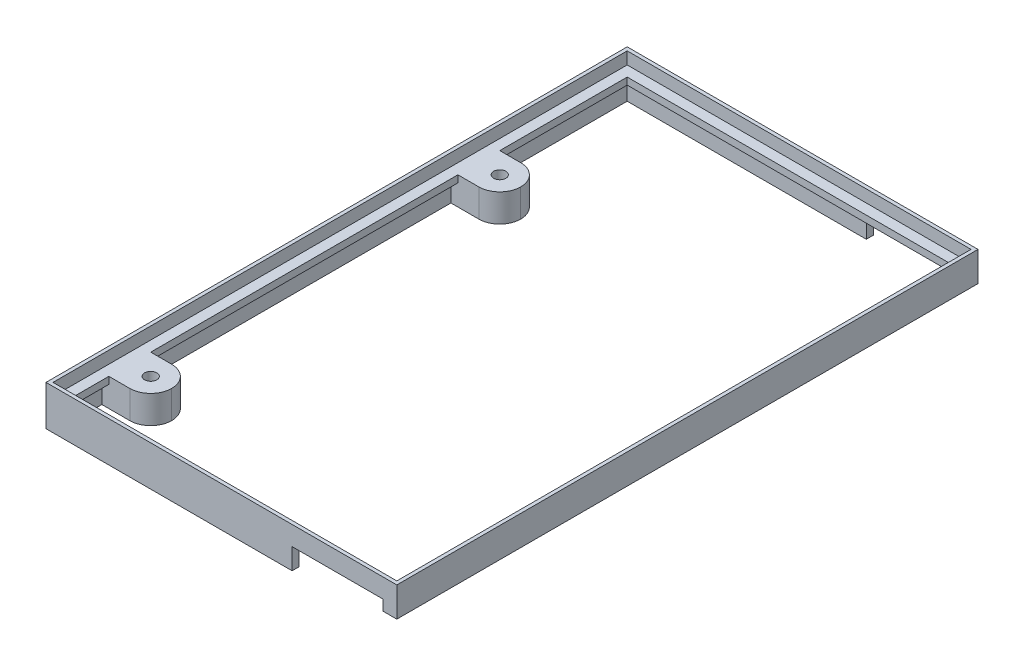
from build123d import *

# Parameters (mm, degrees)
SKETCH2_W                                      = 100.5
SKETCH2_H                                      = 166.5
SKETCH2_W_2                                    = 98.5
SKETCH2_H_2                                    = 164.5
DIAPLAY_RING_DEPTH                             = 3.5
SKETCH3_W                                      = 100.5
SKETCH3_H                                      = 166.5
SKETCH3_W_2                                    = 92.5
SKETCH3_H_2                                    = 158.5
DISPLAY_LIP_DEPTH                              = 2
SKETCH4_W                                      = 16
SKETCH4_H                                      = 12
SKETCH4_R                                      = 1.75
DISPLAY_MOUNTING_TABS_DEPTH                    = 8
FILLET1_R                                      = 6
SKETCH7_W                                      = 100.5
SKETCH7_H                                      = 166.5
SKETCH7_W_2                                    = 96.5
SKETCH7_H_2                                    = 162.5
PERIMETER_EXTENSION_FOR_STRUCTURE_DEPTH        = 7
PERIMETER_EXTENSION_FOR_CAR_TRIM_DEPTH         = 2
SKETCH9_W                                      = 4
SKETCH9_H                                      = 166.5
MATERIAL_ADDITION_FOR_DISPLAY_MOUNTING_S_DEPTH = 4
SKETCH10_W                                     = 150
SKETCH10_H                                     = 1.25
DISPLAY_MOUNTING_SLOT_DEPTH                    = 3
SKETCH6_R                                      = 1.75
SHIFTER_SCREW_IF_DEPTH                         = 3
CUT_EXTRUDE2_DEPTH                             = 137.888640873
CUT_EXTRUDE2_DEPTH_BACK                        = 137.888640873


with BuildPart() as part:
    # Sketch2 → DIAPLAY RING (new body)
    with BuildSketch(Plane(origin=(0, 0, 0), x_dir=(1, 0, 0), z_dir=(0, 1, 0))):
        Rectangle(SKETCH2_W, SKETCH2_H)
        Rectangle(SKETCH2_W_2, SKETCH2_H_2, mode=Mode.SUBTRACT)
    extrude(amount=DIAPLAY_RING_DEPTH)

    # Sketch3 → DISPLAY LIP (add)
    with BuildSketch(Plane(origin=(0, 0, 0), x_dir=(1, 0, 0), z_dir=(0, 1, 0))):
        Rectangle(SKETCH3_W, SKETCH3_H)
        Rectangle(SKETCH3_W_2, SKETCH3_H_2, mode=Mode.SUBTRACT)
    extrude(amount=-DISPLAY_LIP_DEPTH)

    # Sketch4 → DISPLAY MOUNTING TABS (add)
    # profile 1 of 2: a face of its own
    with BuildSketch(Plane(origin=(0, 0, 0), x_dir=(1, 0, 0), z_dir=(0, 1, 0))):
        with Locations((-42.25, -63.25)):
            Rectangle(SKETCH4_W, SKETCH4_H)
        with Locations(Location((-40.25, -63.25, 0), (0, 0, 270))):
            Circle(SKETCH4_R, mode=Mode.SUBTRACT)
    # profile 2 of 2: a face of its own
    with BuildSketch(Plane(origin=(0, 0, 0), x_dir=(1, 0, 0), z_dir=(0, 1, 0))):
        with Locations((-42.25, 36.75)):
            Rectangle(SKETCH4_W, SKETCH4_H)
        with Locations(Location((-40.25, 36.75, 0), (0, 0, 270))):
            Circle(SKETCH4_R, mode=Mode.SUBTRACT)
    extrude(amount=-DISPLAY_MOUNTING_TABS_DEPTH)

    # Fillet1
    fillet1_edges = [part.edges().sort_by_distance(p)[0] for p in [
        (-34.25, -4, 57.25),
        (-34.25, -4, 69.25),
        (-34.25, -4, -42.75),
        (-34.25, -4, -30.75),
    ]]
    fillet(fillet1_edges, radius=FILLET1_R - 0.0001)  # a hair under: the kernel refuses the full size

    # Sketch7 → PERIMETER EXTENSION FOR STRUCTURE (add)
    with BuildSketch(Plane(origin=(0, -1, 0), x_dir=(1, 0, 0), z_dir=(0, 1, 0))):
        Rectangle(SKETCH7_W, SKETCH7_H)
        Rectangle(SKETCH7_W_2, SKETCH7_H_2, mode=Mode.SUBTRACT)
    extrude(amount=-PERIMETER_EXTENSION_FOR_STRUCTURE_DEPTH)

    # Sketch8 → PERIMETER EXTENSION FOR CAR TRIM (add)
    with BuildSketch(Plane.XZ.offset(8)):
        Polygon((25.25, 83.25), (50.25, 83.25), (50.25, -83.25), (25.25, -83.25), (25.25, -81.25), (48.25, -81.25), (48.25, 81.25), (25.25, 81.25), align=None)
    extrude(amount=PERIMETER_EXTENSION_FOR_CAR_TRIM_DEPTH)

    # Sketch9 → MATERIAL ADDITION FOR DISPLAY MOUNTING SLOT (add)
    with BuildSketch(Plane(origin=(0, -1, 0), x_dir=(1, 0, 0), z_dir=(0, 1, 0))):
        with Locations((48.25, 0)):
            Rectangle(SKETCH9_W, SKETCH9_H)
    extrude(amount=-MATERIAL_ADDITION_FOR_DISPLAY_MOUNTING_S_DEPTH)

    # Sketch10 → DISPLAY MOUNTING SLOT (cut)
    with BuildSketch(Plane.ZY.offset(-46.25)):
        with Locations((0, -2.5)):
            Rectangle(SKETCH10_W, SKETCH10_H)
    extrude(amount=-DISPLAY_MOUNTING_SLOT_DEPTH, mode=Mode.SUBTRACT)

    # Sketch11 → Cut-Extrude2 (cut, two sides: drawn at the far end of the back side and taken through both)
    with BuildSketch(Plane.XY.offset(-CUT_EXTRUDE2_DEPTH_BACK)):
        Polygon((50.25, -10), (50.25, -5), (46.25, -5), (46.25, -2), (20.25, -2), (20.25, -10), align=None)
    extrude(amount=CUT_EXTRUDE2_DEPTH + CUT_EXTRUDE2_DEPTH_BACK, mode=Mode.SUBTRACT)


with BuildPart() as body_2:
    # Sketch6 → SHIFTER SCREW IF (new body)
    with BuildSketch(Plane(origin=(0, -55, 0), x_dir=(1, 0, 0), z_dir=(0, 1, 0))):
        with BuildLine():
            Line((-50, 106.5), (12, 106.5))
            ThreePointArc((12, 106.5), (25.5, 93), (12, 79.5))
            Line((12, 79.5), (-50, 79.5))
            ThreePointArc((-50, 79.5), (-63.5, 93), (-50, 106.5))
        make_face()
        with Locations(Location((-50, 93, 0), (0, 0, 270))):
            Circle(SKETCH6_R, mode=Mode.SUBTRACT)
        with Locations(Location((12, 93, 0), (0, 0, 270))):
            Circle(SKETCH6_R, mode=Mode.SUBTRACT)
    extrude(amount=-SHIFTER_SCREW_IF_DEPTH)


solid = part.part
